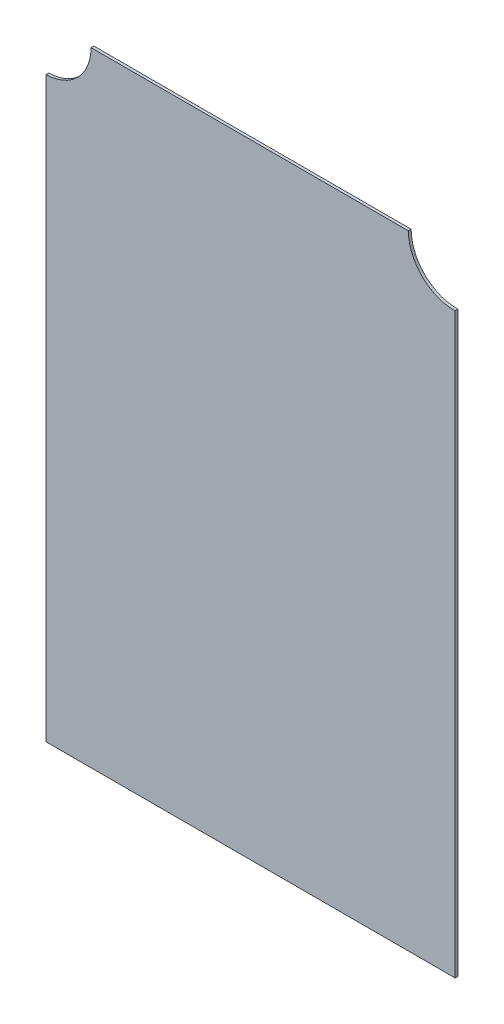
from build123d import *

# Parameters (mm, degrees)
SKETCH_1_W          = 446
SKETCH_1_H          = 680
EXTRUDE_5892_DEPTH  = 3
SKETCH_3_R          = 50
CUT_EXTRUDE_1_DEPTH = 3
SKETCH_4_R          = 50
CUT_EXTRUDE_2_DEPTH = 3


with BuildPart() as part:
    # Эскиз1 → Extrude 5892 (new body)
    with BuildSketch(Plane.XY):
        with Locations((223, 340)):
            Rectangle(SKETCH_1_W, SKETCH_1_H)
    extrude(amount=EXTRUDE_5892_DEPTH)

    # Эскиз3 → Cut-Extrude 1 (cut)
    with BuildSketch(Plane.XY.offset(3)):
        with Locations((-1, 680)):
            Circle(SKETCH_3_R)
    extrude(amount=-CUT_EXTRUDE_1_DEPTH, mode=Mode.SUBTRACT)

    # Эскиз4 → Cut-Extrude 2 (cut)
    with BuildSketch(Plane.XY.offset(3)):
        with Locations((445, 680)):
            Circle(SKETCH_4_R)
    extrude(amount=-CUT_EXTRUDE_2_DEPTH, mode=Mode.SUBTRACT)


solid = part.part
